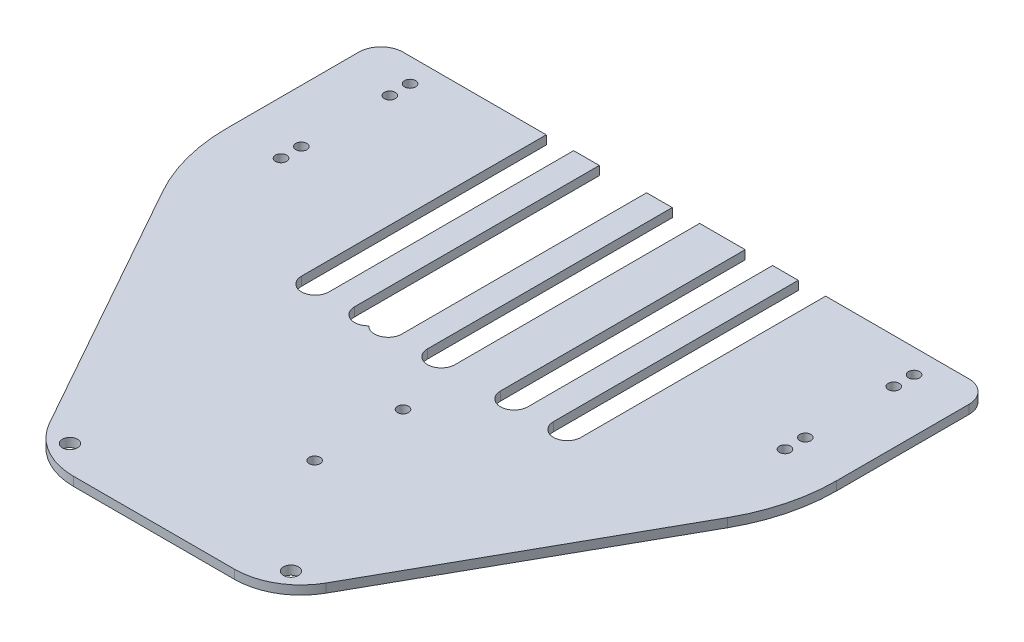
from build123d import *

# Parameters (mm, degrees)
SKETCH1_W                  = 138
SKETCH1_H                  = 120.35
BOSS_EXTRUDE1_DEPTH        = 2
CUT_EXTRUDE1_DEPTH         = 184.117783134
CUT_EXTRUDE2_DEPTH         = 184.117783134
LINEAR_BEARING_D           = 2.5
BELT_HOLDERS_D             = 2.5
F_3_4_3_4_DIAMETER_HOLE1_D = 3.4
CUT_EXTRUDE3_DEPTH         = 184.117783134
FILLET1_R                  = 5
FILLET2_R                  = 40
FILLET3_R                  = 15


with BuildPart() as part:
    # Sketch1 → Boss-Extrude1 (new body)
    with BuildSketch(Plane(origin=(0, 0, 0), x_dir=(1, 0, 0), z_dir=(0, 1, 0))):
        with Locations((69, 60.175)):
            Rectangle(SKETCH1_W, SKETCH1_H)
    extrude(amount=BOSS_EXTRUDE1_DEPTH)

    # Sketch3 → Cut-Extrude1 (cut, through all)
    with BuildSketch(Plane(origin=(0, 2, 0), x_dir=(1, 0, 0), z_dir=(0, 1, 0))):
        with BuildLine():
            Line((88.6, 120.35), (88.6, 65))
            ThreePointArc((88.6, 65), (85.5, 61.9), (82.4, 65))
            Line((82.4, 65), (82.4, 120.35))
            Line((82.4, 120.35), (88.6, 120.35))
        make_face()
        with BuildLine():
            Line((72.1, 120.35), (72.1, 65))
            ThreePointArc((72.1, 65), (69, 61.9), (65.9, 65))
            Line((65.9, 65), (65.9, 120.35))
            Line((65.9, 120.35), (72.1, 120.35))
        make_face()
        with BuildLine():
            Line((100.6, 120.35), (100.6, 65))
            ThreePointArc((100.6, 65), (97.5, 61.9), (94.4, 65))
            Line((94.4, 65), (94.4, 120.35))
            Line((94.4, 120.35), (100.6, 120.35))
        make_face()
        with BuildLine():
            Line((60.1, 120.35), (60.1, 65))
            ThreePointArc((60.1, 65), (57, 61.9), (53.9, 65))
            Line((53.9, 65), (53.9, 120.35))
            Line((53.9, 120.35), (60.1, 120.35))
        make_face()
        with BuildLine():
            Line((43.6, 120.35), (43.6, 65))
            ThreePointArc((43.6, 65), (40.5, 61.9), (37.4, 65))
            Line((37.4, 65), (37.4, 120.35))
            Line((37.4, 120.35), (43.6, 120.35))
        make_face()
    extrude(amount=-CUT_EXTRUDE1_DEPTH, mode=Mode.SUBTRACT)

    # Sketch4 → Cut-Extrude2 (cut, through all)
    with BuildSketch(Plane(origin=(0, 2, 0), x_dir=(1, 0, 0), z_dir=(0, 1, 0))):
        with BuildLine():
            Line((49.4, 120.35), (55.6, 120.35))
            Line((55.6, 120.35), (55.6, 65))
            ThreePointArc((55.6, 65), (52.5, 61.9), (49.4, 65))
            Line((49.4, 65), (49.4, 120.35))
        make_face()
    extrude(amount=-CUT_EXTRUDE2_DEPTH, mode=Mode.SUBTRACT)

    # linear bearing (through all)
    with Locations(Plane(origin=(0, 2, 0), x_dir=(1, 0, 0), z_dir=(0, 1, 0))):
        with Locations((12, 110.35), (12, 90.35), (126, 110.35), (126, 90.35), (75, 50.35), (75, 30.35)):
            Hole(LINEAR_BEARING_D / 2)

    # belt holders (through all)
    with Locations(Plane(origin=(0, 2, 0), x_dir=(1, 0, 0), z_dir=(0, 1, 0))):
        with Locations((12, 114.95), (12, 85.75), (126, 85.75), (126, 114.95)):
            Hole(BELT_HOLDERS_D / 2)

    # Ø3.4 (3.4) Diameter Hole1 (through all)
    with Locations(Plane(origin=(0, 2, 0), x_dir=(1, 0, 0), z_dir=(0, 1, 0))):
        with Locations((94, 6), (44, 6)):
            Hole(F_3_4_3_4_DIAMETER_HOLE1_D / 2)

    # Sketch9 → Cut-Extrude3 (cut, through all)
    with BuildSketch(Plane(origin=(0, 2, 0), x_dir=(1, 0, 0), z_dir=(0, 1, 0))):
        Polygon((0, 75), (42, 0), (0, 0), align=None)
        Polygon((138, 0), (138, 75), (96, 0), align=None)
    extrude(amount=-CUT_EXTRUDE3_DEPTH, mode=Mode.SUBTRACT)

    # Fillet1
    fillet1_edges = [part.edges().sort_by_distance(p)[0] for p in [
        (138, 1, -120.35),
        (0, 1, -120.35),
    ]]
    fillet(fillet1_edges, radius=FILLET1_R)

    # Fillet2
    fillet2_edges = [part.edges().sort_by_distance(p)[0] for p in [
        (138, 1, -75),
        (0, 1, -75),
    ]]
    fillet(fillet2_edges, radius=FILLET2_R)

    # Fillet3
    fillet3_edges = [part.edges().sort_by_distance(p)[0] for p in [
        (96, 1, 0),
        (42, 1, 0),
    ]]
    fillet(fillet3_edges, radius=FILLET3_R)


solid = part.part
